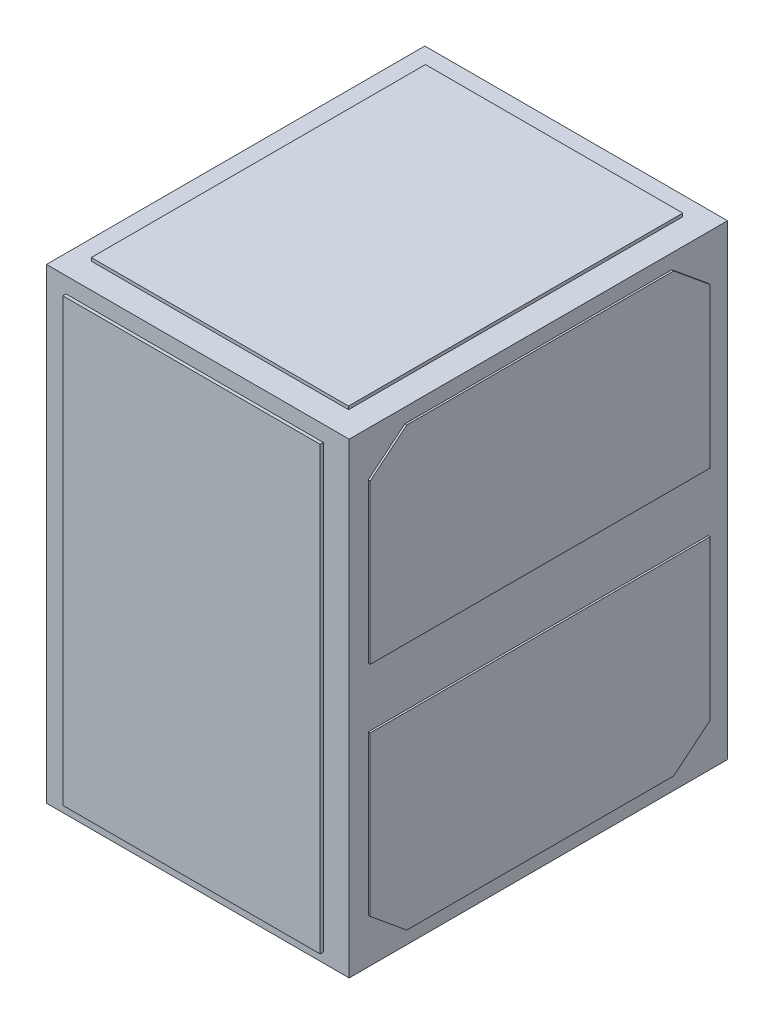
from build123d import *

# Parameters (mm, degrees)
SKETCH1_W            = 240
SKETCH1_H            = 300
BOSS_EXTRUDE1_DEPTH  = 370
SKETCH2_R            = 4.3
BOSS_EXTRUDE2_DEPTH  = 2.5
SKETCH3_W            = 204
SKETCH3_H            = 265
BOSS_EXTRUDE3_DEPTH  = 2.5
SKETCH8_R            = 4.286085294
BOSS_EXTRUDE6_DEPTH  = 2.5
SKETCH9_W            = 204
SKETCH9_H            = 265
BOSS_EXTRUDE7_DEPTH  = 2.5
SKETCH10_R           = 4.3
BOSS_EXTRUDE8_DEPTH  = 2.5
SKETCH12_W           = 204
SKETCH12_H           = 350
BOSS_EXTRUDE9_DEPTH  = 2.5
BOSS_EXTRUDE10_START = 2.5
SKETCH13_R           = 4.3
BOSS_EXTRUDE10_DEPTH = 2.5
SKETCH14_W           = 204
SKETCH14_H           = 350
BOSS_EXTRUDE11_DEPTH = 2.5
BOSS_EXTRUDE12_DEPTH = 1.5
BOSS_EXTRUDE13_DEPTH = 1.5


with BuildPart() as part:
    # Sketch1 → Boss-Extrude1 (new body)
    with BuildSketch(Plane(origin=(0, 0, 0), x_dir=(1, 0, 0), z_dir=(0, 1, 0))):
        Rectangle(SKETCH1_W, SKETCH1_H)
    extrude(amount=BOSS_EXTRUDE1_DEPTH)

    # Sketch2 → Boss-Extrude2 (add)
    with BuildSketch(Plane(origin=(0, 370, 0), x_dir=(1, 0, 0), z_dir=(0, 1, 0))):
        with Locations((-86, 120)):
            Circle(SKETCH2_R)
        with Locations((86, 120)):
            Circle(SKETCH2_R)
        with Locations((86, -120)):
            Circle(SKETCH2_R)
        with Locations((-86, -120)):
            Circle(SKETCH2_R)
    extrude(amount=BOSS_EXTRUDE2_DEPTH)

    # Sketch3 → Boss-Extrude3 (add)
    with BuildSketch(Plane(origin=(0, 372.5, 0), x_dir=(1, 0, 0), z_dir=(0, 1, 0))):
        Rectangle(SKETCH3_W, SKETCH3_H)
    extrude(amount=BOSS_EXTRUDE3_DEPTH)

    # Sketch8 → Boss-Extrude6 (add)
    with BuildSketch(Plane.XZ):
        with Locations((-86, 120)):
            Circle(SKETCH8_R)
        with Locations((86, 120)):
            Circle(SKETCH8_R)
        with Locations((86, -120)):
            Circle(SKETCH8_R)
        with Locations((-86, -120)):
            Circle(SKETCH8_R)
    extrude(amount=BOSS_EXTRUDE6_DEPTH)

    # Sketch9 → Boss-Extrude7 (add)
    with BuildSketch(Plane.XZ.offset(2.5)):
        Rectangle(SKETCH9_W, SKETCH9_H)
    extrude(amount=BOSS_EXTRUDE7_DEPTH)

    # Sketch10 → Boss-Extrude8 (add)
    with BuildSketch(Plane.XY.offset(150)):
        with Locations((-86, 345)):
            Circle(SKETCH10_R)
        with Locations((86, 345)):
            Circle(SKETCH10_R)
        with Locations((86, 25)):
            Circle(SKETCH10_R)
        with Locations((-86, 25)):
            Circle(SKETCH10_R)
    extrude(amount=BOSS_EXTRUDE8_DEPTH)

    # Sketch12 → Boss-Extrude9 (add)
    with BuildSketch(Plane.XY.offset(152.5)):
        with Locations((0, 185)):
            Rectangle(SKETCH12_W, SKETCH12_H)
    extrude(amount=BOSS_EXTRUDE9_DEPTH)

    # Sketch13 → Boss-Extrude10 (add)
    with BuildSketch(Plane(origin=(0, 0, -150), x_dir=(-1, 0, 0), z_dir=(0, 0, -1)).offset(BOSS_EXTRUDE10_START)):
        with Locations((-86, 345)):
            Circle(SKETCH13_R)
        with Locations((86, 345)):
            Circle(SKETCH13_R)
        with Locations((-86, 25)):
            Circle(SKETCH13_R)
        with Locations((86, 25)):
            Circle(SKETCH13_R)
    extrude(amount=-BOSS_EXTRUDE10_DEPTH)

    # Sketch14 → Boss-Extrude11 (add)
    with BuildSketch(Plane(origin=(0, 0, -152.5), x_dir=(-1, 0, 0), z_dir=(0, 0, -1))):
        with Locations((0, 185)):
            Rectangle(SKETCH14_W, SKETCH14_H)
    extrude(amount=BOSS_EXTRUDE11_DEPTH)

    # Sketch15 → Boss-Extrude12 (add)
    with BuildSketch(Plane.ZY.offset(120)):
        Polygon((-134.788231979, 161.45540947), (134.788231979, 161.45540947), (134.788231979, 35.45540947), (105.855505742, 11.598600117), (-105.855505742, 11.598600117), (-134.788231979, 35.45540947), align=None)
        Polygon((-134.788231979, 334.54459053), (-105.855505742, 358.401399883), (105.855505742, 358.401399883), (134.788231979, 334.54459053), (134.788231979, 208.54459053), (-134.788231979, 208.54459053), align=None)
    extrude(amount=BOSS_EXTRUDE12_DEPTH)

    # Sketch17 → Boss-Extrude13 (add)
    with BuildSketch(Plane(origin=(120, 0, 0), x_dir=(0, 0, -1), z_dir=(1, 0, 0))):
        Polygon((-134.788231979, 208.54459053), (134.788231979, 208.54459053), (134.788231979, 334.54459053), (105.855505742, 358.401399883), (-105.855505742, 358.401399883), (-134.788231979, 334.54459053), align=None)
        Polygon((-134.788231979, 161.45540947), (134.788231979, 161.45540947), (134.788231979, 35.45540947), (105.855505742, 11.598600117), (-105.855505742, 11.598600117), (-134.788231979, 35.45540947), align=None)
    extrude(amount=BOSS_EXTRUDE13_DEPTH)


solid = part.part
